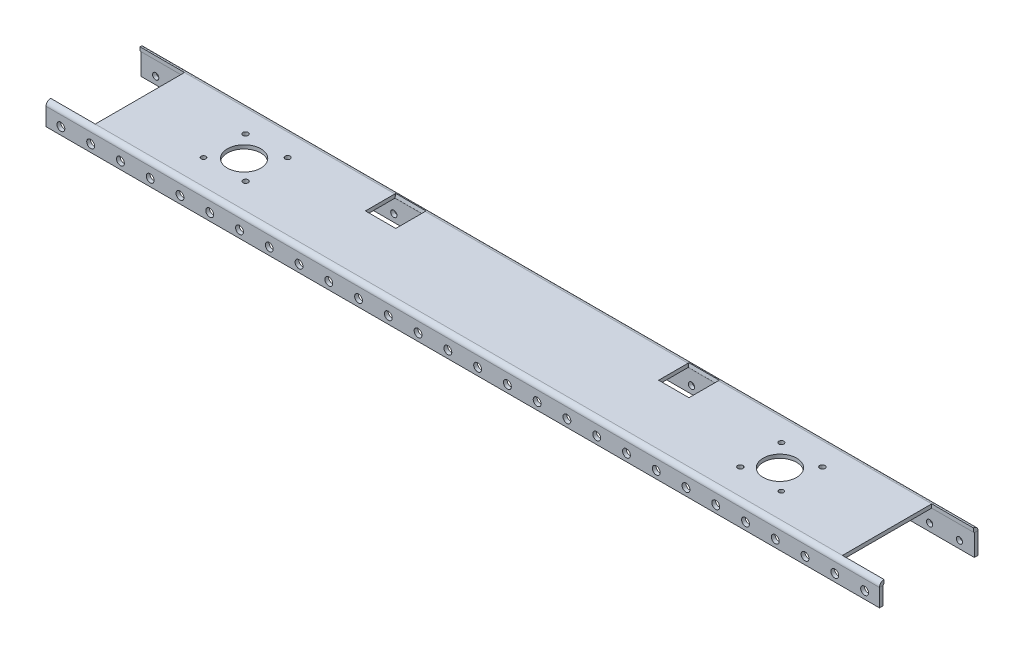
from build123d import *

# Parameters (mm, degrees)
SKETCH1_W             = 711.2
SKETCH1_H             = 76.2
BOSS_EXTRUDE1_DEPTH   = 3.175
EDGE_FLANGE1_DEPTH    = 711.2
EDGE_FLANGE2_DEPTH    = 711.2
SKETCH14_R            = 2.667
UPPER_FLANGE_HP_DEPTH = 25.4
SKETCH16_R            = 3.3528
LOWER_FLANGE_HP_DEPTH = 717.03979687
LPATTERN1_COUNT       = 32
LPATTERN1_PITCH       = 25.4
SKETCH29_R            = 14.2875
CUT_EXTRUDE16_DEPTH   = 717.045619632
SKETCH31_W            = 35.56
SKETCH31_H            = 76.2
CUT_EXTRUDE11_DEPTH   = 716.954105561
SKETCH32_W            = 38.1
SKETCH32_H            = 76.2
CUT_EXTRUDE12_DEPTH   = 716.954105561
CUT_EXTRUDE13_START   = 217.547646287
CUT_EXTRUDE13_DEPTH   = 25.908
CUT_EXTRUDE13_START_2 = 467.744353713
CUT_EXTRUDE13_2_DEPTH = 25.908
SKETCH33_R            = 2.2479
SKETCH33_R_2          = 2.15
SKETCH33_R_3          = 2.24647347
SKETCH33_R_4          = 2.0193
CUT_EXTRUDE14_DEPTH   = 716.954105561


# Read off the part's stored shape, not the designer's step: Cut-Extrude13
# Sheet-metal steps are written as plain solids
with BuildPart() as part:
    # Sketch1 → Boss-Extrude1 (new body)
    with BuildSketch(Plane(origin=(0, 0, 0), x_dir=(1, 0, 0), z_dir=(0, 1, 0))):
        with Locations((355.6, 38.1)):
            Rectangle(SKETCH1_W, SKETCH1_H)
    extrude(amount=BOSS_EXTRUDE1_DEPTH)

    # Edge-Flange1 section (across the edge) → Edge-Flange1 (add)
    with BuildSketch(Plane(origin=(711.2, 0, 0.762), x_dir=(0, 0, -1), z_dir=(-1, 0, 0))):
        with BuildLine():
            Line((-3.175, 0.762), (-3.175, 15.875))
            Line((-3.175, 15.875), (0, 15.875))
            Line((0, 15.875), (0, 0.762))
            ThreePointArc((0, 0.762), (0.223184633, 0.223184633), (0.762, 0))
            Line((0.762, 0), (0.762, -3.175))
            ThreePointArc((0.762, -3.175), (-2.021879398, -2.021879398), (-3.175, 0.762))
        make_face()
    extrude(amount=EDGE_FLANGE1_DEPTH)

    # Edge-Flange2 section (across the edge) → Edge-Flange2 (add)
    with BuildSketch(Plane(origin=(0, 0, -76.962), x_dir=(0, 0, 1), z_dir=(1, 0, 0))):
        with BuildLine():
            Line((-3.175, 0.762), (-3.175, 19.05))
            Line((-3.175, 19.05), (0, 19.05))
            Line((0, 19.05), (0, 0.762))
            ThreePointArc((0, 0.762), (0.223184633, 0.223184633), (0.762, 0))
            Line((0.762, 0), (0.762, -3.175))
            ThreePointArc((0.762, -3.175), (-2.021879398, -2.021879398), (-3.175, 0.762))
        make_face()
    extrude(amount=EDGE_FLANGE2_DEPTH)

    # Sketch14 → upper flange HP (cut)
    with BuildSketch(Plane(origin=(0, 0, -80.137), x_dir=(-1, 0, 0), z_dir=(0, 0, -1))):
        with Locations(Location((-12.7, -12.7, 0), (0, 0, 90))):
            Circle(SKETCH14_R)
        with Locations(Location((-38.1, -12.7, 0), (0, 0, 90))):
            Circle(SKETCH14_R)
        with Locations(Location((-63.5, -12.7, 0), (0, 0, 90))):
            Circle(SKETCH14_R)
        with Locations(Location((-88.9, -12.7, 0), (0, 0, 90))):
            Circle(SKETCH14_R)
        with Locations(Location((-114.3, -12.7, 0), (0, 0, 90))):
            Circle(SKETCH14_R)
        with Locations(Location((-139.7, -12.7, 0), (0, 0, 90))):
            Circle(SKETCH14_R)
        with Locations(Location((-165.1, -12.7, 0), (0, 0, 90))):
            Circle(SKETCH14_R)
        with Locations(Location((-190.5, -12.7, 0), (0, 0, 90))):
            Circle(SKETCH14_R)
        with Locations(Location((-215.9, -12.7, 0), (0, 0, 90))):
            Circle(SKETCH14_R)
        with Locations(Location((-241.3, -12.7, 0), (0, 0, 90))):
            Circle(SKETCH14_R)
        with Locations(Location((-266.7, -12.7, 0), (0, 0, 90))):
            Circle(SKETCH14_R)
        with Locations(Location((-292.1, -12.7, 0), (0, 0, 90))):
            Circle(SKETCH14_R)
        with Locations(Location((-317.5, -12.7, 0), (0, 0, 90))):
            Circle(SKETCH14_R)
        with Locations(Location((-342.9, -12.7, 0), (0, 0, 90))):
            Circle(SKETCH14_R)
        with Locations(Location((-368.3, -12.7, 0), (0, 0, 90))):
            Circle(SKETCH14_R)
        with Locations(Location((-393.7, -12.7, 0), (0, 0, 90))):
            Circle(SKETCH14_R)
        with Locations(Location((-419.1, -12.7, 0), (0, 0, 90))):
            Circle(SKETCH14_R)
        with Locations(Location((-444.5, -12.7, 0), (0, 0, 90))):
            Circle(SKETCH14_R)
        with Locations(Location((-469.9, -12.7, 0), (0, 0, 90))):
            Circle(SKETCH14_R)
        with Locations(Location((-495.3, -12.7, 0), (0, 0, 90))):
            Circle(SKETCH14_R)
        with Locations(Location((-520.7, -12.7, 0), (0, 0, 90))):
            Circle(SKETCH14_R)
        with Locations(Location((-546.1, -12.7, 0), (0, 0, 90))):
            Circle(SKETCH14_R)
        with Locations(Location((-571.5, -12.7, 0), (0, 0, 90))):
            Circle(SKETCH14_R)
        with Locations(Location((-596.9, -12.7, 0), (0, 0, 90))):
            Circle(SKETCH14_R)
        with Locations(Location((-622.3, -12.7, 0), (0, 0, 90))):
            Circle(SKETCH14_R)
        with Locations(Location((-647.7, -12.7, 0), (0, 0, 90))):
            Circle(SKETCH14_R)
        with Locations(Location((-673.1, -12.7, 0), (0, 0, 90))):
            Circle(SKETCH14_R)
        with Locations(Location((-698.5, -12.7, 0), (0, 0, 90))):
            Circle(SKETCH14_R)
        with Locations((-723.9, -12.7)):
            Circle(SKETCH14_R)
        with Locations((-749.3, -12.7)):
            Circle(SKETCH14_R)
        with Locations((-774.7, -12.7)):
            Circle(SKETCH14_R)
        with Locations((-800.1, -12.7)):
            Circle(SKETCH14_R)
    extrude(amount=-UPPER_FLANGE_HP_DEPTH, mode=Mode.SUBTRACT)

    # Sketch16 → Lower flange HP (cut, through all)
    with BuildSketch(Plane(origin=(0, 0, 0.762), x_dir=(-1, 0, 0), z_dir=(0, 0, -1))):
        with Locations(Location((-698.5, -9.525, 0), (0, 0, 90))):
            Circle(SKETCH16_R)
    lower_flange_hp = extrude(amount=-LOWER_FLANGE_HP_DEPTH, mode=Mode.SUBTRACT)

    # LPattern1: Lower flange HP ×32
    with Locations(*[(-i * LPATTERN1_PITCH, 0, 0) for i in range(1, LPATTERN1_COUNT)]):
        add(lower_flange_hp, mode=Mode.SUBTRACT)

    # Sketch29 → Cut-Extrude16 (cut, through all)
    with BuildSketch(Plane(origin=(0, 3.175, 0), x_dir=(1, 0, 0), z_dir=(0, 1, 0))):
        with Locations(Location((584.2, 38.1, 0), (0, 0, 270))):
            Circle(SKETCH29_R)
        with Locations(Location((127, 38.1, 0), (0, 0, 270))):
            Circle(SKETCH29_R)
    extrude(amount=-CUT_EXTRUDE16_DEPTH, mode=Mode.SUBTRACT)

    # Sketch31 → Cut-Extrude11 (cut, through all)
    with BuildSketch(Plane.XZ):
        with Locations((693.42, -38.1)):
            Rectangle(SKETCH31_W, SKETCH31_H)
    extrude(amount=-CUT_EXTRUDE11_DEPTH, mode=Mode.SUBTRACT)

    # Sketch32 → Cut-Extrude12 (cut, through all)
    with BuildSketch(Plane.XZ):
        with Locations((19.05, -38.1)):
            Rectangle(SKETCH32_W, SKETCH32_H)
    extrude(amount=-CUT_EXTRUDE12_DEPTH, mode=Mode.SUBTRACT)

    # Cut-Extrude13 outline → Cut-Extrude13 (cut)
    with BuildSketch(Plane.YZ.offset(CUT_EXTRUDE13_START)):
        with BuildLine():
            Line((3.175, -76.2), (3.175, -51.054))
            Line((3.175, -51.054), (0, -51.054))
            Line((0, -51.054), (0, -76.2))
            ThreePointArc((0, -76.2), (-0.003610771, -76.274093029), (-0.014408863, -76.347483871))
            Line((-0.014408863, -76.347483871), (3.100554207, -76.962))
            ThreePointArc((3.100554207, -76.962), (3.156344352, -76.582813981), (3.175, -76.2))
        make_face()
    extrude(amount=CUT_EXTRUDE13_DEPTH, mode=Mode.SUBTRACT)

    # Cut-Extrude13 2 outline → Cut-Extrude13 2 (cut)
    with BuildSketch(Plane.YZ.offset(CUT_EXTRUDE13_START_2)):
        with BuildLine():
            Line((3.175, -76.2), (3.175, -51.054))
            Line((3.175, -51.054), (0, -51.054))
            Line((0, -51.054), (0, -76.2))
            ThreePointArc((0, -76.2), (-0.003610771, -76.274093029), (-0.014408863, -76.347483871))
            Line((-0.014408863, -76.347483871), (3.100554207, -76.962))
            ThreePointArc((3.100554207, -76.962), (3.156344352, -76.582813981), (3.175, -76.2))
        make_face()
    extrude(amount=CUT_EXTRUDE13_2_DEPTH, mode=Mode.SUBTRACT)

    # Sketch33 → Cut-Extrude14 (cut, through all)
    with BuildSketch(Plane(origin=(0, 0, 0), x_dir=(-1, 0, 0), z_dir=(0, -1, 0))):
        with Locations(Location((-109.5127, 56.848002955, 0), (0, 0, 270))):
            Circle(SKETCH33_R)
        with Locations(Location((-144.973212242, 57.308515197, 0), (0, 0, 270))):
            Circle(SKETCH33_R_2)
        with Locations(Location((-144.5127, 21.848002955, 0), (0, 0, 270))):
            Circle(SKETCH33_R_3)
        with Locations(Location((-109.052187758, 21.387490713, 0), (0, 0, 270))):
            Circle(SKETCH33_R_4)
        with Locations(Location((-602.147812242, 21.387490713, 0), (0, 0, 90))):
            Circle(SKETCH33_R_4)
        with Locations(Location((-566.6873, 21.848002955, 0), (0, 0, 90))):
            Circle(SKETCH33_R_3)
        with Locations(Location((-566.226787758, 57.308515197, 0), (0, 0, 90))):
            Circle(SKETCH33_R_2)
        with Locations(Location((-601.6873, 56.848002955, 0), (0, 0, 90))):
            Circle(SKETCH33_R)
    extrude(amount=-CUT_EXTRUDE14_DEPTH, mode=Mode.SUBTRACT)


solid = part.part
